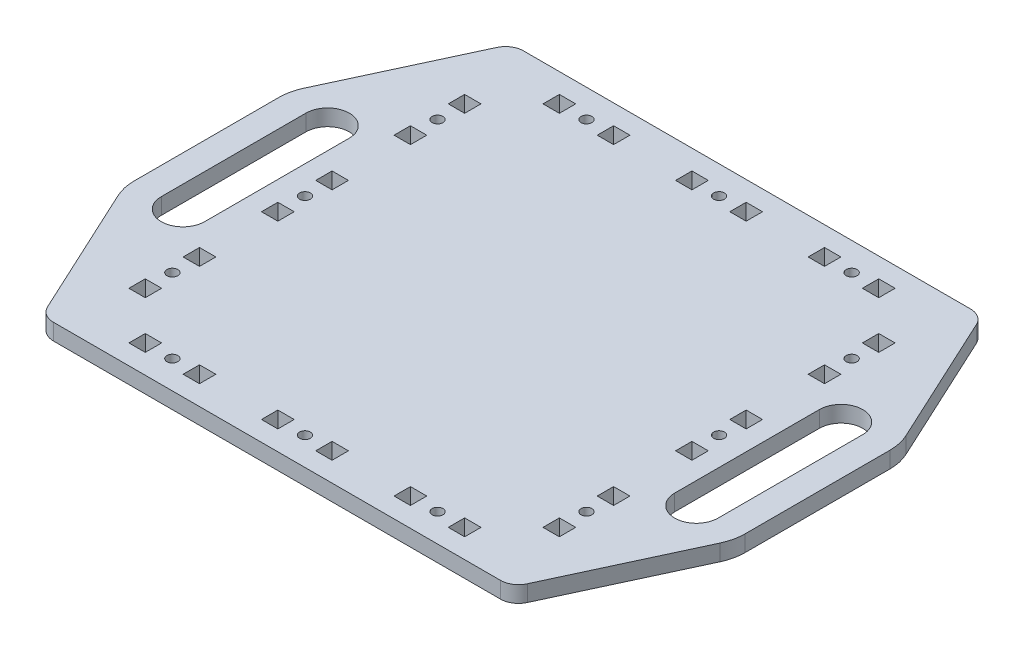
from build123d import *

# Parameters (mm, degrees)
SKETCH1_R           = 3
SKETCH1_W           = 9.05
SKETCH1_H           = 9.05
BOSS_EXTRUDE1_DEPTH = 9


with BuildPart() as part:
    # Sketch1 → Boss-Extrude1 (new body)
    with BuildSketch(Plane(origin=(0, 0, 0), x_dir=(1, 0, 0), z_dir=(0, 1, 0))):
        with BuildLine():
            Line((-123.616316268, -130), (123.616316268, -130))
            ThreePointArc((123.616316268, -130), (128.997093015, -128.428952581), (132.687178677, -124.209448321))
            Line((132.687178677, -124.209448321), (166.491328503, -51.365510467))
            ThreePointArc((166.491328503, -51.365510467), (168.365373784, -45.819541667), (169, -40))
            Line((169, -40), (169, 40))
            ThreePointArc((169, 40), (168.365373784, 45.819541667), (166.491328503, 51.365510467))
            Line((166.491328503, 51.365510467), (132.687178677, 124.209448321))
            ThreePointArc((132.687178677, 124.209448321), (128.997093015, 128.428952581), (123.616316268, 130))
            Line((123.616316268, 130), (-123.616316268, 130))
            ThreePointArc((-123.616316268, 130), (-128.997093015, 128.428952581), (-132.687178677, 124.209448321))
            Line((-132.687178677, 124.209448321), (-166.491328503, 51.365510467))
            ThreePointArc((-166.491328503, 51.365510467), (-168.365373784, 45.819541667), (-169, 40))
            Line((-169, 40), (-169, -40))
            ThreePointArc((-169, -40), (-168.365373784, -45.819541667), (-166.491328503, -51.365510467))
            Line((-166.491328503, -51.365510467), (-132.687178677, -124.209448321))
            ThreePointArc((-132.687178677, -124.209448321), (-128.997093015, -128.428952581), (-123.616316268, -130))
        make_face()
        with Locations((0, 114.525)):
            Circle(SKETCH1_R, mode=Mode.SUBTRACT)
        with Locations((-73.333333333, 114.525)):
            Circle(SKETCH1_R, mode=Mode.SUBTRACT)
        with Locations((73.333333333, 114.525)):
            Circle(SKETCH1_R, mode=Mode.SUBTRACT)
        with Locations((114.525, 73.333333333)):
            Circle(SKETCH1_R, mode=Mode.SUBTRACT)
        with Locations((114.525, 0)):
            Circle(SKETCH1_R, mode=Mode.SUBTRACT)
        with Locations((114.525, -73.333333333)):
            Circle(SKETCH1_R, mode=Mode.SUBTRACT)
        with Locations((73.333333333, -114.525)):
            Circle(SKETCH1_R, mode=Mode.SUBTRACT)
        with Locations((0, -114.525)):
            Circle(SKETCH1_R, mode=Mode.SUBTRACT)
        with Locations((-73.333333333, -114.525)):
            Circle(SKETCH1_R, mode=Mode.SUBTRACT)
        with Locations((-114.525, -73.333333333)):
            Circle(SKETCH1_R, mode=Mode.SUBTRACT)
        with Locations((-114.525, 0)):
            Circle(SKETCH1_R, mode=Mode.SUBTRACT)
        with Locations((-114.525, 73.333333333)):
            Circle(SKETCH1_R, mode=Mode.SUBTRACT)
        with BuildLine():
            Line((154, 40), (154, -40))
            ThreePointArc((154, -40), (142, -52), (130, -40))
            Line((130, -40), (130, 40))
            ThreePointArc((130, 40), (142, 52), (154, 40))
        make_face(mode=Mode.SUBTRACT)
        with BuildLine():
            Line((-154, 40), (-154, -40))
            ThreePointArc((-154, -40), (-142, -52), (-130, -40))
            Line((-130, -40), (-130, 40))
            ThreePointArc((-130, 40), (-142, 52), (-154, 40))
        make_face(mode=Mode.SUBTRACT)
        with Locations((15, 114.525)):
            Rectangle(SKETCH1_W, SKETCH1_H, mode=Mode.SUBTRACT)
        with Locations((-15, 114.525)):
            Rectangle(SKETCH1_W, SKETCH1_H, mode=Mode.SUBTRACT)
        with Locations((-58.333333333, 114.525)):
            Rectangle(SKETCH1_W, SKETCH1_H, mode=Mode.SUBTRACT)
        with Locations((-88.333333333, 114.525)):
            Rectangle(SKETCH1_W, SKETCH1_H, mode=Mode.SUBTRACT)
        with Locations((88.333333333, 114.525)):
            Rectangle(SKETCH1_W, SKETCH1_H, mode=Mode.SUBTRACT)
        with Locations((58.333333333, 114.525)):
            Rectangle(SKETCH1_W, SKETCH1_H, mode=Mode.SUBTRACT)
        with Locations((114.525, 58.333333333)):
            Rectangle(SKETCH1_W, SKETCH1_H, mode=Mode.SUBTRACT)
        with Locations((114.525, 88.333333333)):
            Rectangle(SKETCH1_W, SKETCH1_H, mode=Mode.SUBTRACT)
        with Locations((114.525, -15)):
            Rectangle(SKETCH1_W, SKETCH1_H, mode=Mode.SUBTRACT)
        with Locations((114.525, 15)):
            Rectangle(SKETCH1_W, SKETCH1_H, mode=Mode.SUBTRACT)
        with Locations((114.525, -88.333333333)):
            Rectangle(SKETCH1_W, SKETCH1_H, mode=Mode.SUBTRACT)
        with Locations((114.525, -58.333333333)):
            Rectangle(SKETCH1_W, SKETCH1_H, mode=Mode.SUBTRACT)
        with Locations((58.333333333, -114.525)):
            Rectangle(SKETCH1_W, SKETCH1_H, mode=Mode.SUBTRACT)
        with Locations((88.333333333, -114.525)):
            Rectangle(SKETCH1_W, SKETCH1_H, mode=Mode.SUBTRACT)
        with Locations((-15, -114.525)):
            Rectangle(SKETCH1_W, SKETCH1_H, mode=Mode.SUBTRACT)
        with Locations((15, -114.525)):
            Rectangle(SKETCH1_W, SKETCH1_H, mode=Mode.SUBTRACT)
        with Locations((-88.333333333, -114.525)):
            Rectangle(SKETCH1_W, SKETCH1_H, mode=Mode.SUBTRACT)
        with Locations((-58.333333333, -114.525)):
            Rectangle(SKETCH1_W, SKETCH1_H, mode=Mode.SUBTRACT)
        with Locations((-114.525, -58.333333333)):
            Rectangle(SKETCH1_W, SKETCH1_H, mode=Mode.SUBTRACT)
        with Locations((-114.525, -88.333333333)):
            Rectangle(SKETCH1_W, SKETCH1_H, mode=Mode.SUBTRACT)
        with Locations((-114.525, 15)):
            Rectangle(SKETCH1_W, SKETCH1_H, mode=Mode.SUBTRACT)
        with Locations((-114.525, -15)):
            Rectangle(SKETCH1_W, SKETCH1_H, mode=Mode.SUBTRACT)
        with Locations((-114.525, 88.333333333)):
            Rectangle(SKETCH1_W, SKETCH1_H, mode=Mode.SUBTRACT)
        with Locations((-114.525, 58.333333333)):
            Rectangle(SKETCH1_W, SKETCH1_H, mode=Mode.SUBTRACT)
    extrude(amount=BOSS_EXTRUDE1_DEPTH)


solid = part.part
